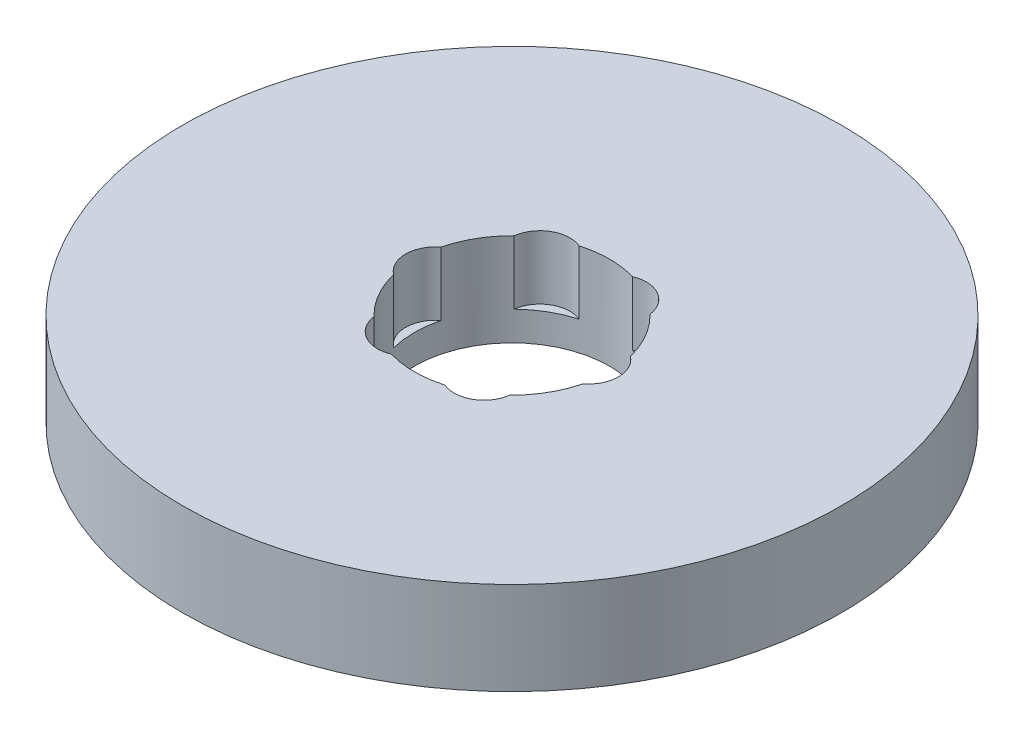
from build123d import *

# Parameters (mm, degrees)
SKETCH1_R           = 67.5
BOSS_EXTRUDE1_DEPTH = 19
SKETCH2_R           = 20
CUT_EXTRUDE1_DEPTH  = 98.331906382
SKETCH3_R           = 6.12678653
CUT_EXTRUDE2_DEPTH  = 13.019431903
CIRPATTERN1_COUNT   = 6


with BuildPart() as part:
    # Sketch1 → Boss-Extrude1 (new body)
    with BuildSketch(Plane(origin=(0, 0, 0), x_dir=(1, 0, 0), z_dir=(0, 1, 0))):
        Circle(SKETCH1_R)
    extrude(amount=BOSS_EXTRUDE1_DEPTH)

    # Sketch2 → Cut-Extrude1 (cut, through all)
    with BuildSketch(Plane(origin=(0, 0, 0), x_dir=(1, 0, 0), z_dir=(0, 1, 0))):
        Circle(SKETCH2_R)
    extrude(amount=CUT_EXTRUDE1_DEPTH, mode=Mode.SUBTRACT)

    # Sketch3 → Cut-Extrude2 (cut)
    with BuildSketch(Plane(origin=(0, 19, 0), x_dir=(1, 0, 0), z_dir=(0, 1, 0))):
        with Locations((-15.672143417, 0)):
            Circle(SKETCH3_R)
    cut_extrude2 = extrude(amount=-CUT_EXTRUDE2_DEPTH, mode=Mode.SUBTRACT)

    # CirPattern1: Cut-Extrude2 ×6 about axis
    cirpattern1_axis = Axis((0, 0, 0), (0, 1, 0))
    for i in range(1, CIRPATTERN1_COUNT):
        add(cut_extrude2.rotate(cirpattern1_axis, i * 360 / CIRPATTERN1_COUNT), mode=Mode.SUBTRACT)


solid = part.part
